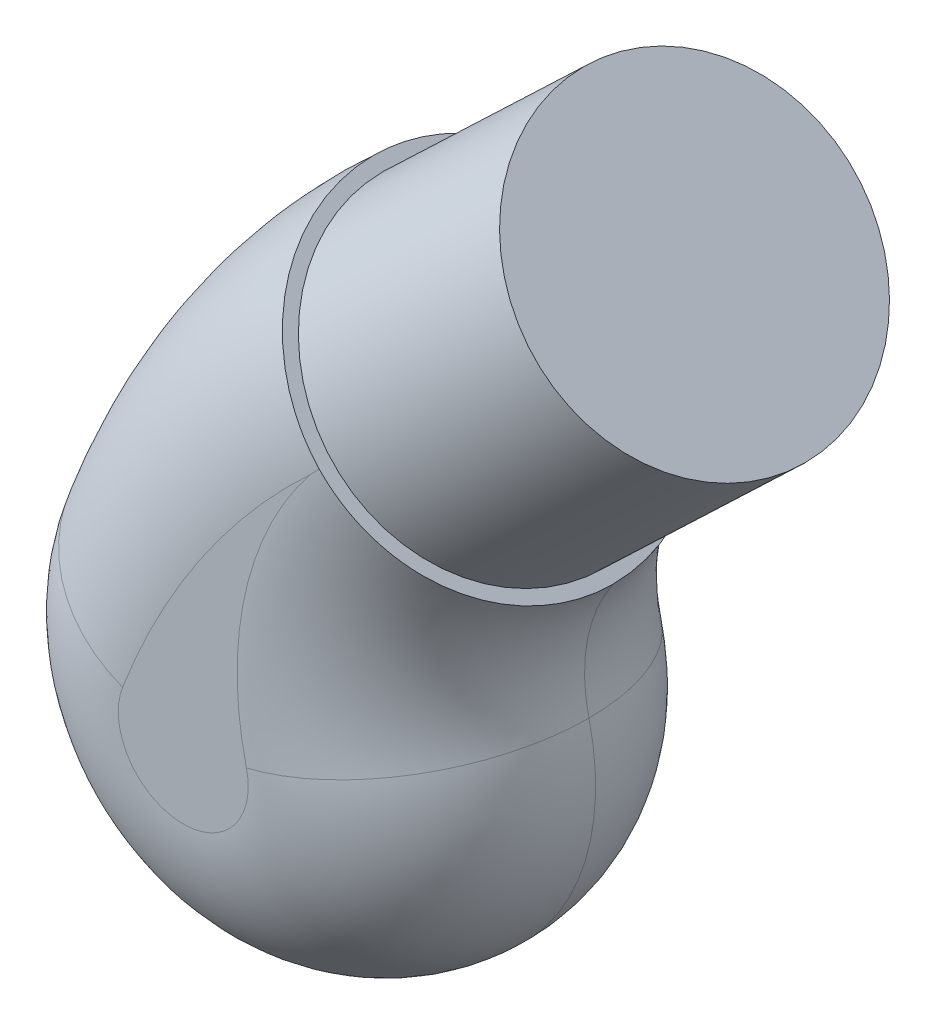
from build123d import *

# Parameters (mm, degrees)
BOSS_EXTRUDE1_DEPTH = 25
FILLET1_ANGLE       = 27.256571
FILLET1_2_ANGLE     = 214.454112
FILLET1_3_ANGLE     = 54.523986
BOSS_EXTRUDE2_DEPTH = 20
SKETCH4_R           = 11.55
BOSS_EXTRUDE3_DEPTH = 20


with BuildPart() as part:
    # Sketch2 → Boss-Extrude1 (new body)
    with BuildSketch(Plane.XY):
        with BuildLine():
            ThreePointArc((16.695481749, 4.030209956), (16.575469403, 8.82948354), (18.439335728, 13.253670723))
            Line((18.439335728, 13.253670723), (1.191582265, 31.351046237))
            ThreePointArc((1.191582265, 31.351046237), (-8.916313316, 19.75380413), (-16.046827969, 6.122174061))
            ThreePointArc((-16.046827969, 6.122174061), (-1.095110216, -17.140082752), (16.695481749, 4.030209956))
        make_face()
    extrude(amount=BOSS_EXTRUDE1_DEPTH)

    # Fillet1: read off the stored shape, not the designer's step
    # Fillet1 outline → Fillet1 (revolve, cut)
    with BuildSketch(Plane(origin=(45.27231793, -17.272260647, 0), x_dir=(-0.6673207357903113, 0.7447704583187209, 0), z_dir=(0.7447704583187209, 0.6673207357903113, 0))):
        with BuildLine():
            ThreePointArc((65.630307245, 12.5), (61.96914201, 3.661165235), (53.130307245, 0))
            Line((53.130307245, 0), (65.630307245, 0))
            Line((65.630307245, 0), (65.630307245, 12.5))
        make_face()
        with BuildLine():
            ThreePointArc((53.130307245, 25), (61.96914201, 21.338834765), (65.630307245, 12.5))
            Line((65.630307245, 12.5), (65.630307245, 25))
            Line((65.630307245, 25), (53.130307245, 25))
        make_face()
    revolve(axis=Axis((45.27231793, -17.272260647, 0), (0, 0, 1)), revolution_arc=FILLET1_ANGLE, mode=Mode.SUBTRACT)

    # Fillet1 2 outline → Fillet1 2 (revolve, cut)
    with BuildSketch(Plane(origin=(0, 0, 0), x_dir=(-0.9343114269174442, 0.356457792075709, 0), z_dir=(0.356457792075709, 0.9343114269174442, 0))):
        with BuildLine():
            ThreePointArc((17.175031386, 12.5), (13.513866151, 3.661165235), (4.675031386, 0))
            Line((4.675031386, 0), (17.175031386, 0))
            Line((17.175031386, 0), (17.175031386, 12.5))
        make_face()
        with BuildLine():
            ThreePointArc((4.675031386, 25), (13.513866151, 21.338834765), (17.175031386, 12.5))
            Line((17.175031386, 12.5), (17.175031386, 25))
            Line((17.175031386, 25), (4.675031386, 25))
        make_face()
    revolve(axis=Axis((0, 0, 0), (0, 0, 1)), revolution_arc=FILLET1_2_ANGLE, mode=Mode.SUBTRACT)

    # Fillet1 3 outline → Fillet1 3 (revolve, cut)
    with BuildSketch(Plane(origin=(27.791881525, 6.708827813, 0), x_dir=(-0.755251050967347, 0.6554356185108632, 0), z_dir=(0.6554356185108632, 0.755251050967347, 0))):
        with BuildLine():
            ThreePointArc((23.915125125, 0), (15.07629036, 3.661165235), (11.415125125, 12.5))
            ThreePointArc((11.415125125, 12.5), (15.07629036, 21.338834765), (23.915125125, 25))
            Line((23.915125125, 25), (0, 25))
            Line((0, 25), (0, 0))
            Line((0, 0), (23.915125125, 0))
        make_face()
    revolve(axis=Axis((27.791881525, 6.708827813, 0), (0, 0, 1)), revolution_arc=FILLET1_3_ANGLE, mode=Mode.SUBTRACT)

    # Sketch3 → Boss-Extrude2 (add)
    with BuildSketch(Plane(origin=(16.28183603, 15.51744857, 0), x_dir=(0, 0, -1), z_dir=(0.7238950205462975, 0.689910138516804, 0))):
        with BuildLine():
            add(Edge.make_bspline(
                [(-12.5, 20.872781575), (-13.256668139, 20.872783302), (-14.000739855, 20.79881073), (-15.098725324, 20.581427208), (-15.461678458, 20.491101322), (-16.181362745, 20.273910071), (-16.539184388, 20.146395237), (-17.580284009, 19.716702167), (-18.238808791, 19.366085439), (-19.173819976, 18.744896669), (-19.477482866, 18.521152694), (-20.062713338, 18.043490327), (-20.341290031, 17.792156843), (-21.136253577, 17.00185096), (-21.612268684, 16.426924712), (-22.24356028, 15.490857573), (-22.440003661, 15.166129183), (-22.796391307, 14.50612924), (-23.1187343, 13.832119756), (-23.37417024, 13.130577693), (-23.595730444, 12.415095599), (-23.689852392, 12.048946993), (-23.917308897, 10.939216126), (-23.995503885, 10.191000747), (-23.999860972, 9.434345392)],
                knots=[0, 0, 0, 0, 0.125, 0.125, 0.1875, 0.1875, 0.25, 0.25, 0.375, 0.375, 0.4375, 0.4375, 0.5, 0.5, 0.625, 0.625, 0.6875, 0.6875, 0.75, 0.8125, 0.8125, 0.875, 0.875, 1, 1, 1, 1], degree=3))
            add(Edge.make_bspline(
                [(-23.999860972, 9.434345392), (-23.996140108, 8.673949048), (-23.918521624, 7.926531477), (-23.696119049, 6.824017675), (-23.604194154, 6.459637687), (-23.384046374, 5.737252794), (-23.255109601, 5.377966861), (-22.821299038, 4.332097389), (-22.4684037, 3.670544318), (-21.636877733, 2.417904815), (-21.153165557, 1.82340781), (-20.096391068, 0.75538362), (-19.520332011, 0.275442623), (-18.583042659, -0.36144191), (-18.257210639, -0.560332334), (-17.59457102, -0.920958023), (-17.256263168, -1.083852584), (-16.22099128, -1.521816354), (-15.502186237, -1.746448083), (-14.013070638, -2.050842838), (-13.260547219, -2.127218425), (-12.5, -2.127218425)],
                knots=[0, 0, 0, 0, 0.125, 0.125, 0.1875, 0.1875, 0.25, 0.25, 0.375, 0.375, 0.5, 0.5, 0.625, 0.625, 0.6875, 0.6875, 0.75, 0.75, 0.875, 0.875, 1, 1, 1, 1], degree=3))
            add(Edge.make_bspline(
                [(-12.5, -2.127218425), (-11.739951783, -2.127220159), (-10.99298274, -2.050953602), (-9.891243761, -1.827423826), (-9.527138939, -1.734594918), (-8.805330439, -1.511610249), (-8.447027671, -1.380955069), (-7.405368997, -0.941566343), (-6.746852838, -0.583764468), (-5.812080094, 0.048657861), (-5.507990701, 0.276728473), (-4.925203492, 0.760295915), (-4.647677713, 1.014556559), (-3.855417752, 1.813612152), (-3.380608745, 2.394327897), (-2.750542265, 3.339309437), (-2.555352052, 3.665512733), (-2.200634738, 4.328941881), (-1.879486858, 5.006483662), (-1.62461868, 5.711889515), (-1.403437836, 6.431457566), (-1.309384468, 6.800035835), (-1.082652346, 7.913685357), (-1.004493644, 8.664749127), (-1.000138932, 9.42453918)],
                knots=[0, 0, 0, 0, 0.125, 0.125, 0.1875, 0.1875, 0.25, 0.25, 0.375, 0.375, 0.4375, 0.4375, 0.5, 0.5, 0.625, 0.625, 0.6875, 0.6875, 0.75, 0.8125, 0.8125, 0.875, 0.875, 1, 1, 1, 1], degree=3))
            add(Edge.make_bspline(
                [(-1.000138932, 9.42453918), (-1.003858377, 10.181599932), (-1.120284499, 11.297746686), (-1.396152663, 12.38592469), (-1.616837561, 13.104926142), (-1.746226262, 13.462294055), (-2.181078725, 14.502028599), (-2.534976545, 15.159282124), (-3.160808146, 16.091874442), (-3.385907391, 16.394636796), (-3.866661712, 16.978055074), (-4.119570523, 17.255527322), (-4.914129627, 18.047235479), (-5.491646985, 18.520723725), (-6.431186182, 19.147723677), (-6.757046383, 19.342774236), (-7.419230774, 19.696069822), (-7.757263319, 19.855548502), (-8.446848802, 20.141058966), (-8.798379325, 20.267146202), (-9.515296315, 20.485043686), (-9.882061099, 20.577108914), (-10.993778189, 20.798707299), (-11.742885367, 20.872781575), (-12.5, 20.872781575)],
                knots=[0, 0, 0, 0, 0.125, 0.1875, 0.1875, 0.25, 0.25, 0.375, 0.375, 0.4375, 0.4375, 0.5, 0.5, 0.625, 0.625, 0.6875, 0.6875, 0.75, 0.75, 0.8125, 0.8125, 0.875, 0.875, 1, 1, 1, 1], degree=3))
        make_face()
    extrude(amount=BOSS_EXTRUDE2_DEPTH)

    # Sketch4 → Boss-Extrude3 (add)
    with BuildSketch(Plane(origin=(30.759736441, 29.31565134, 0), x_dir=(0, 0, -1), z_dir=(0.7238950205462988, 0.6899101385168025, 4.126088551647398e-14))):
        with Locations(Location((-12.506772123, 9.364766291, 0), (0, 0, 90))):
            Circle(SKETCH4_R)
    extrude(amount=-BOSS_EXTRUDE3_DEPTH)


solid = part.part
